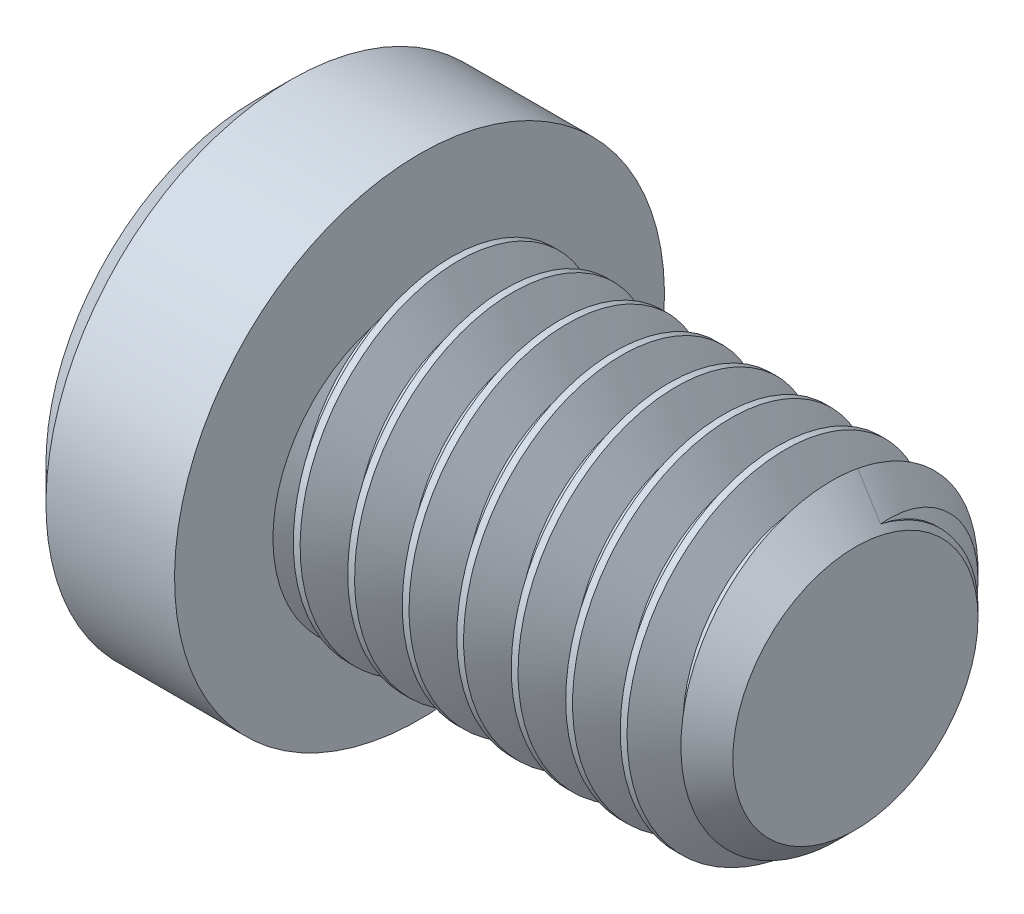
from build123d import *

# Parameters (mm, degrees)
SKETCH2_R           = 4.7625
BOSS_EXTRUDE1_DEPTH = 12.7
CHAMFER1_SIZE       = 1.190625
CUT_SWEEP1_PITCH    = 1.5875
CUT_EXTRUDE1_DEPTH  = 2.921


with BuildPart() as part:
    # Sketch2 → Boss-Extrude1 (new body)
    with BuildSketch(Plane(origin=(6.35, 0, 0), x_dir=(0, 0, -1), z_dir=(1, 0, 0))):
        Circle(SKETCH2_R)
    extrude(amount=-BOSS_EXTRUDE1_DEPTH)

    # Chamfer1
    chamfer1_edges = [part.edges().sort_by_distance(p)[0] for p in [
        (6.35, 0, 4.7625),
    ]]
    chamfer(chamfer1_edges, length=CHAMFER1_SIZE)

    # Cut-Sweep1: the profile of Sketch5 profile screwed along a right-hand helix of 9 turns, 8 arcs to a turn; built about Z, then put on its axis
    cut_sweep1_z = Axis((0, 0, 0), (0, 0, 1))
    cut_sweep1_corners = [(4.7628, 0, 0.694704455), (4.7628, 0, -0.694704455), (3.731388504, 0, -0.09921875), (3.731388504, 0, 0.09921875)]
    with BuildLine(mode=Mode.PRIVATE) as cut_sweep1_profile:
        Line(cut_sweep1_corners[0], cut_sweep1_corners[1])
        Line(cut_sweep1_corners[1], cut_sweep1_corners[2])
        Line(cut_sweep1_corners[2], cut_sweep1_corners[3])
        Line(cut_sweep1_corners[3], cut_sweep1_corners[0])
    cut_sweep1_cap = Face(cut_sweep1_profile.wire())
    cut_sweep1_turn_angles = [0, 22.5, 45, 67.5, 90, 112.5, 135, 157.5, 180, 202.5, 225, 247.5, 270, 292.5, 315, 337.5, 360]
    cut_sweep1_turn_weights = [1, 0.9238795325112867, 1, 0.9238795325112867, 1, 0.9238795325112867, 1, 0.9238795325112867, 1, 0.9238795325112867, 1, 0.9238795325112867, 1, 0.9238795325112867, 1, 0.9238795325112867, 1]
    cut_sweep1_turn_rails = [Edge.make_bspline([Vector(p[0], p[1], 0).rotate(cut_sweep1_z, cut_sweep1_turn_angles[k]) / cut_sweep1_turn_weights[k] + Vector(0, 0, p[2] + CUT_SWEEP1_PITCH * cut_sweep1_turn_angles[k] / 360) for k in range(17)], [0, 0, 0, 1, 1, 2, 2, 3, 3, 4, 4, 5, 5, 6, 6, 7, 7, 8, 8, 8], 2, cut_sweep1_turn_weights) for p in cut_sweep1_corners]
    cut_sweep1_turn_sides = [Face.make_surface_from_curves(cut_sweep1_turn_rails[p[0]], cut_sweep1_turn_rails[p[1]]) for p in [(0, 1), (1, 2), (2, 3), (3, 0)]]
    cut_sweep1 = Plane(origin=(6.35, 0, 0), x_dir=(0, 1, 0), z_dir=(-1, 0, 0)) * Solid(Shell([*[p.moved(Location((0, 0, CUT_SWEEP1_PITCH * i))) for i in range(9) for p in cut_sweep1_turn_sides], cut_sweep1_cap, cut_sweep1_cap.rotate(cut_sweep1_z, 3240).moved(Location((0, 0, CUT_SWEEP1_PITCH * 3240 / 360)))]))
    add(cut_sweep1, mode=Mode.SUBTRACT)

    # Sketch6 → Revolve1 (revolve)
    with BuildSketch(Plane.XY, mode=Mode.PRIVATE) as revolve1_sk:
        Polygon((-10.0965, 7.1374), (-11.1125, 6.1214), (-11.1125, 0), (-6.35, 0), (-6.35, 7.1374), align=None)
    revolve(revolve1_sk.sketch.rotate(Axis((-6.35, 0, 0), (-1, 0, 0)), 13.865622854), axis=Axis((-6.35, 0, 0), (-1, 0, 0)))

    # Sketch4 → Cut-Extrude1 (cut)
    with BuildSketch(Plane(origin=(-11.1125, 0, 0), x_dir=(0, 0, -1), z_dir=(1, 0, 0))):
        Polygon((0, 2.749630657), (-2.38125, 1.374815329), (-2.38125, -1.374815329), (0, -2.749630657), (2.38125, -1.374815329), (2.38125, 1.374815329), align=None)
    extrude(amount=CUT_EXTRUDE1_DEPTH, mode=Mode.SUBTRACT)

    # Cut-Extrude2 cone 1 section (through the dimple's axis) → Cut-Extrude2 (revolve, cut)
    with BuildSketch(Plane(origin=(-11.1125, 0, 0), x_dir=(0, 0, 1), z_dir=(0, 1, 0))):
        Polygon((0, 0), (2.749630657, 0), (0, 2.749630657), align=None)
    revolve(axis=Axis((-11.1125, 0, 0), (1, 0, 0)), mode=Mode.SUBTRACT)


solid = part.part
